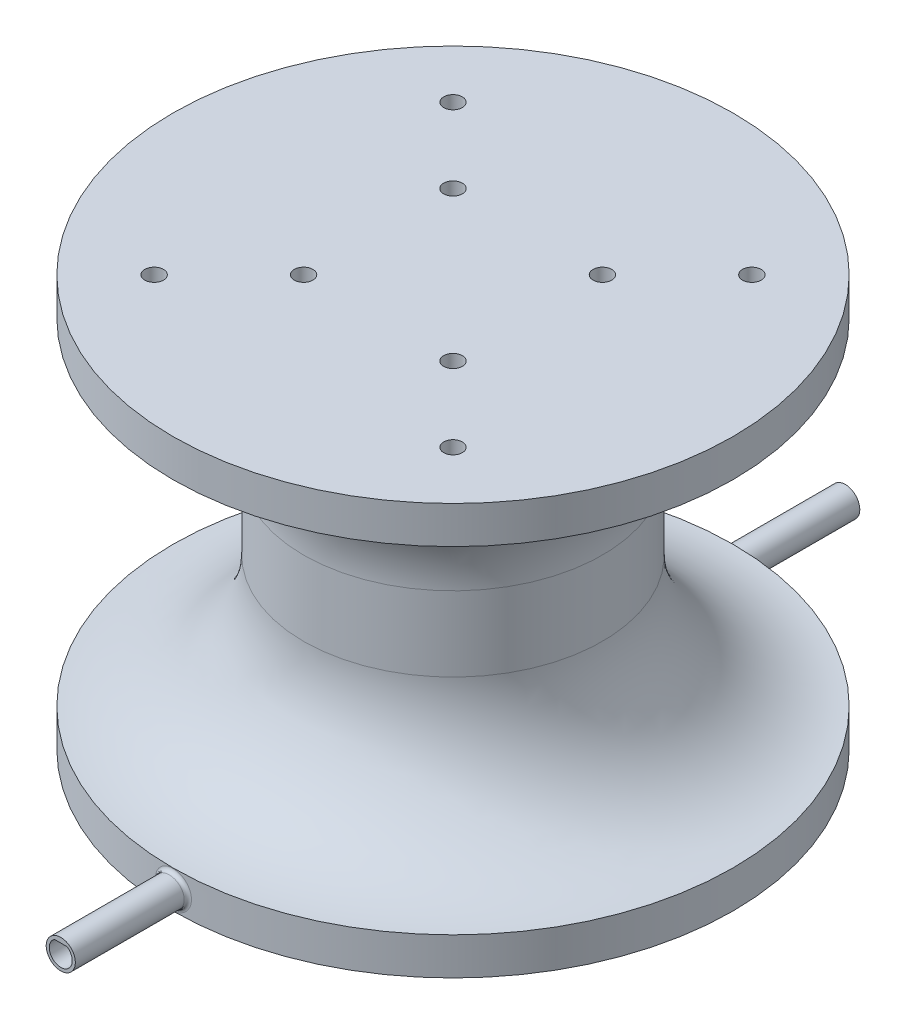
from build123d import *

# Parameters (mm, degrees)
SKETCH1_R               = 75
BOSS_EXTRUDE1_DEPTH     = 10
SKETCH2_R               = 3.9
BOSS_EXTRUDE2_DEPTH     = 105
SKETCH4_W               = 28
SKETCH4_H               = 20
BOSS_EXTRUDE3_DEPTH     = 15
SKETCH5_R               = 1.4
CUT_EXTRUDE2_DEPTH      = 7
FILLET1_R               = 1
FILLET2_R               = 1
SKETCH3_R               = 3.075
CUT_EXTRUDE3_DEPTH      = 12.1
SKETCH6_R               = 40
BOSS_EXTRUDE4_DEPTH     = 90
FILLET3_R               = 35
SKETCH7_R               = 75
BOSS_EXTRUDE5_DEPTH     = 10
FILLET5_R               = 35
CUT_EXTRUDE4_DEPTH      = 180.652442332
CUT_EXTRUDE4_DEPTH_BACK = 14
SKETCH8_R               = 2.5
SKETCH12_W              = 28
SKETCH12_H              = 10
CUT_EXTRUDE7_DEPTH      = 15
SKETCH13_W              = 24
SKETCH13_H              = 13
CUT_EXTRUDE9_DEPTH      = 15
BOSS_EXTRUDE6_START     = 12.1
BOSS_EXTRUDE6_DEPTH     = 12.1


with BuildPart() as part:
    # Sketch1 → Boss-Extrude1 (new body)
    with BuildSketch(Plane(origin=(0, 0, 0), x_dir=(1, 0, 0), z_dir=(0, 1, 0))):
        with Locations(Location((0, 0, 0), (0, 0, 270))):
            Circle(SKETCH1_R)
    extrude(amount=BOSS_EXTRUDE1_DEPTH)

    # Sketch2 → Boss-Extrude2 (add, symmetric)
    with BuildSketch(Plane.XY):
        with Locations(Location((0, 5, 0), (0, 0, 180))):
            Circle(SKETCH2_R)
    extrude(amount=BOSS_EXTRUDE2_DEPTH, both=True)

    # Sketch4 → Boss-Extrude3 (add)
    with BuildSketch(Plane.XZ):
        Rectangle(SKETCH4_W, SKETCH4_H)
    extrude(amount=BOSS_EXTRUDE3_DEPTH)

    # Sketch5 → Cut-Extrude2 (cut)
    with BuildSketch(Plane.XZ.offset(15)):
        with Locations(Location((-7.53, -5.12, 0), (0, 0, 270))):
            Circle(SKETCH5_R)
        with Locations(Location((7.53, -5.12, 0), (0, 0, 270))):
            Circle(SKETCH5_R)
    extrude(amount=-CUT_EXTRUDE2_DEPTH, mode=Mode.SUBTRACT)

    # Fillet1
    fillet1_edges = [part.edges().sort_by_distance(p)[0] for p in [
        (3.9, 5, 74.898531361),
    ]]
    fillet(fillet1_edges, radius=FILLET1_R)

    # Fillet2
    fillet2_edges = [part.edges().sort_by_distance(p)[0] for p in [
        (3.9, 5, -74.898531361),
    ]]
    fillet(fillet2_edges, radius=FILLET2_R)

    # Sketch3 → Cut-Extrude3 (cut)
    with BuildSketch(Plane.XY.offset(105)):
        with Locations((0, 5)):
            Circle(SKETCH3_R)
    extrude(amount=-CUT_EXTRUDE3_DEPTH, mode=Mode.SUBTRACT)

    # Sketch6 → Boss-Extrude4 (add)
    with BuildSketch(Plane(origin=(0, 10, 0), x_dir=(1, 0, 0), z_dir=(0, 1, 0))):
        with Locations(Location((0, 0, 0), (0, 0, 90))):
            Circle(SKETCH6_R)
    extrude(amount=BOSS_EXTRUDE4_DEPTH)

    # Fillet3
    fillet3_edges = [part.edges().sort_by_distance(p)[0] for p in [
        (0, 10, 40),
    ]]
    fillet(fillet3_edges, radius=FILLET3_R - 0.0001)  # a hair under: the kernel refuses the full size

    # Sketch7 → Boss-Extrude5 (add)
    with BuildSketch(Plane(origin=(0, 100, 0), x_dir=(1, 0, 0), z_dir=(0, 1, 0))):
        with Locations(Location((0, 0, 0), (0, 0, 270))):
            Circle(SKETCH7_R)
    extrude(amount=BOSS_EXTRUDE5_DEPTH)

    # Fillet5
    fillet5_edges = [part.edges().sort_by_distance(p)[0] for p in [
        (0, 100, 40),
    ]]
    fillet(fillet5_edges, radius=FILLET5_R - 0.0001)  # a hair under: the kernel refuses the full size

    # Sketch8 → Cut-Extrude4 (cut, two sides: drawn at the far end of the back side and taken through both)
    with BuildSketch(Plane(origin=(0, 110, 0), x_dir=(1, 0, 0), z_dir=(0, 1, 0)).offset(-CUT_EXTRUDE4_DEPTH_BACK)):
        with Locations(Location((20, 20, 0), (0, 0, 90))):
            Circle(SKETCH8_R)
        with Locations(Location((-20, 20, 0), (0, 0, 90))):
            Circle(SKETCH8_R)
        with Locations(Location((-20, -20, 0), (0, 0, 90))):
            Circle(SKETCH8_R)
        with Locations(Location((20, -20, 0), (0, 0, 90))):
            Circle(SKETCH8_R)
        with Locations(Location((-40, 40, 0), (0, 0, 105.239702329))):
            Circle(SKETCH8_R)
        with Locations(Location((40, 40, 0), (0, 0, 74.760297854))):
            Circle(SKETCH8_R)
        with Locations(Location((40, -40, 0), (0, 0, 344.760297854))):
            Circle(SKETCH8_R)
        with Locations(Location((-40, -40, 0), (0, 0, 195.239702329))):
            Circle(SKETCH8_R)
    extrude(amount=CUT_EXTRUDE4_DEPTH + CUT_EXTRUDE4_DEPTH_BACK, mode=Mode.SUBTRACT)

    # Sketch12 → Cut-Extrude7 (cut)
    with BuildSketch(Plane(origin=(0, -15, 0), x_dir=(-1, 0, 0), z_dir=(0, -1, 0))):
        with Locations((0, -5)):
            Rectangle(SKETCH12_W, SKETCH12_H)
    extrude(amount=-CUT_EXTRUDE7_DEPTH, mode=Mode.SUBTRACT)

    # Sketch13 → Cut-Extrude9 (cut)
    with BuildSketch(Plane.XY):
        with Locations((0, -6.5)):
            Rectangle(SKETCH13_W, SKETCH13_H)
    extrude(amount=-CUT_EXTRUDE9_DEPTH, mode=Mode.SUBTRACT)

    # Sketch14 → Boss-Extrude6 (add)
    with BuildSketch(Plane.XY.offset(92.9).offset(BOSS_EXTRUDE6_START)):
        with BuildLine():
            Line((-1.680773631, 7.575), (1.680773631, 7.575))
            ThreePointArc((1.680773631, 7.575), (0, 8.075), (-1.680773631, 7.575))
        make_face()
    extrude(amount=-BOSS_EXTRUDE6_DEPTH)


solid = part.part
